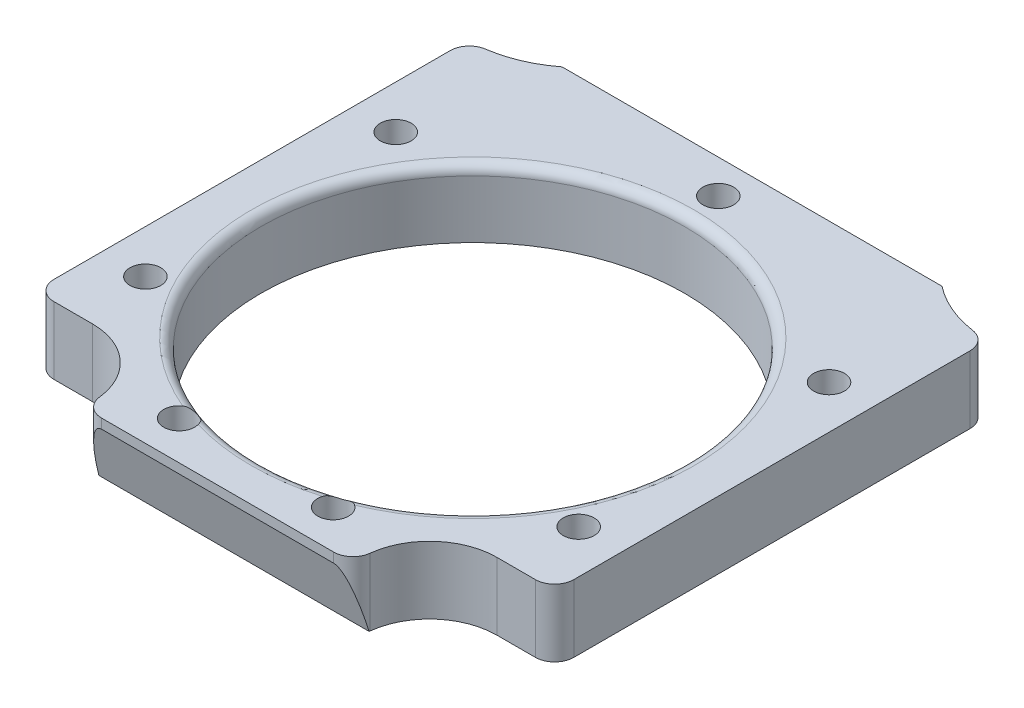
from build123d import *

# Parameters (mm, degrees)
EXTRUDE_1_DEPTH          = 5
SKETCH_3_R               = 22
CUT_EXTRUDE_1_DEPTH      = 75.79973262
SKETCH_4_R               = 1.6
CUT_EXTRUDE_3_DEPTH      = 75.79973262
SKETCH_9_R               = 1.6
SKETCH_9_R_2             = 22
EXTRUDE_2_DEPTH          = 2
FILLET_1_R               = 1
CUT_EXTRUDE_4_DEPTH      = 68.779052811
CUT_EXTRUDE_4_DEPTH_BACK = 68.779052811


with BuildPart() as part:
    # Эскиз2 → Бобышка-Вытянуть1 (new body)
    with BuildSketch(Plane(origin=(0, -5, 0), x_dir=(-1, 0, 0), z_dir=(0, -1, 0))):
        with BuildLine():
            Line((-28.05572809, -61), (-3.94427191, -61))
            ThreePointArc((-3.94427191, -61), (-2.610938577, -60.490711985), (-1.95665593, -59.222222222))
            ThreePointArc((-1.95665593, -59.222222222), (0.333333333, -54.782508053), (5, -53))
            Line((5, -53), (9, -53))
            ThreePointArc((9, -53), (10.414213562, -52.414213562), (11, -51))
            Line((11, -51), (11, -9.854480973))
            ThreePointArc((11, -9.854480973), (10.513111175, -8.546622199), (9.289505428, -7.875545247))
            ThreePointArc((9.289505428, -7.875545247), (6.355962769, -7.049175653), (3.731345838, -5.5))
            Line((3.731345838, -5.5), (-35.731345838, -5.5))
            ThreePointArc((-35.731345838, -5.5), (-38.355962769, -7.049175653), (-41.289505428, -7.875545247))
            ThreePointArc((-41.289505428, -7.875545247), (-42.513111175, -8.546622199), (-43, -9.854480973))
            Line((-43, -9.854480973), (-43, -51))
            ThreePointArc((-43, -51), (-42.414213562, -52.414213562), (-41, -53))
            Line((-41, -53), (-37, -53))
            ThreePointArc((-37, -53), (-32.333333333, -54.782508053), (-30.04334407, -59.222222222))
            ThreePointArc((-30.04334407, -59.222222222), (-29.389061423, -60.490711985), (-28.05572809, -61))
        make_face()
    extrude(amount=EXTRUDE_1_DEPTH)

    # Эскиз3 → Вырез-Вытянуть1 (cut, through all)
    with BuildSketch(Plane.XZ.offset(10)):
        with Locations(Location((16, 34.5, 0), (0, 0, 270))):
            Circle(SKETCH_3_R)
    extrude(amount=-CUT_EXTRUDE_1_DEPTH, mode=Mode.SUBTRACT)

    # Эскиз4 → Вырез-Вытянуть3 (cut, through all)
    with BuildSketch(Plane.XZ.offset(10)):
        with Locations(Location((38.5, 20, 0), (0, 0, 270))):
            Circle(SKETCH_4_R)
        with Locations(Location((-6.5, 20, 0), (0, 0, 270))):
            Circle(SKETCH_4_R)
        with Locations(Location((-6.5, 46, 0), (0, 0, 270))):
            Circle(SKETCH_4_R)
        with Locations(Location((38.5, 46, 0), (0, 0, 270))):
            Circle(SKETCH_4_R)
        with Locations(Location((24, 57, 0), (0, 0, 270))):
            Circle(SKETCH_4_R)
        with Locations(Location((8, 57, 0), (0, 0, 270))):
            Circle(SKETCH_4_R)
        with Locations(Location((16, 9, 0), (0, 0, 270))):
            Circle(SKETCH_4_R)
    extrude(amount=-CUT_EXTRUDE_3_DEPTH, mode=Mode.SUBTRACT)

    # Эскиз9 → Бобышка-Вытянуть2 (add)
    with BuildSketch(Plane.XZ.offset(10)):
        with BuildLine():
            Line((28.05572809, 61), (3.94427191, 61))
            ThreePointArc((3.94427191, 61), (2.610938577, 60.490711985), (1.95665593, 59.222222222))
            ThreePointArc((1.95665593, 59.222222222), (-0.333333333, 54.782508053), (-5, 53))
            Line((-5, 53), (-9, 53))
            ThreePointArc((-9, 53), (-10.414213562, 52.414213562), (-11, 51))
            Line((-11, 51), (-11, 9.854480973))
            ThreePointArc((-11, 9.854480973), (-10.513111175, 8.546622199), (-9.289505428, 7.875545247))
            ThreePointArc((-9.289505428, 7.875545247), (-6.355962769, 7.049175653), (-3.731345838, 5.5))
            Line((-3.731345838, 5.5), (35.731345838, 5.5))
            ThreePointArc((35.731345838, 5.5), (38.355962769, 7.049175653), (41.289505428, 7.875545247))
            ThreePointArc((41.289505428, 7.875545247), (42.513111175, 8.546622199), (43, 9.854480973))
            Line((43, 9.854480973), (43, 51))
            ThreePointArc((43, 51), (42.414213562, 52.414213562), (41, 53))
            Line((41, 53), (37, 53))
            ThreePointArc((37, 53), (32.333333333, 54.782508053), (30.04334407, 59.222222222))
            ThreePointArc((30.04334407, 59.222222222), (29.389061423, 60.490711985), (28.05572809, 61))
        make_face()
        with Locations(Location((38.5, 46, 0), (0, 0, 270))):
            Circle(SKETCH_9_R, mode=Mode.SUBTRACT)
        with Locations(Location((24, 57, 0), (0, 0, 270))):
            Circle(SKETCH_9_R, mode=Mode.SUBTRACT)
        with Locations(Location((38.5, 20, 0), (0, 0, 270))):
            Circle(SKETCH_9_R, mode=Mode.SUBTRACT)
        with Locations(Location((16, 9, 0), (0, 0, 270))):
            Circle(SKETCH_9_R, mode=Mode.SUBTRACT)
        with Locations(Location((-6.5, 20, 0), (0, 0, 270))):
            Circle(SKETCH_9_R, mode=Mode.SUBTRACT)
        with Locations(Location((-6.5, 46, 0), (0, 0, 270))):
            Circle(SKETCH_9_R, mode=Mode.SUBTRACT)
        with Locations(Location((8, 57, 0), (0, 0, 270))):
            Circle(SKETCH_9_R, mode=Mode.SUBTRACT)
        with Locations(Location((16, 34.5, 0), (0, 0, 270))):
            Circle(SKETCH_9_R_2, mode=Mode.SUBTRACT)
    extrude(amount=EXTRUDE_2_DEPTH)

    # Скругление1
    # the kernel refuses this fillet: 1 mm, written as the material it takes off along each edge
    with BuildSketch(Plane(origin=(16, -5, 34.5), x_dir=(0, 0, -1), z_dir=(-1, 0, 0))) as fillet_1_piece_1:
        with BuildLine():
            CenterArc((22 + FILLET_1_R, FILLET_1_R), FILLET_1_R, 180, 90)
            Line((22, FILLET_1_R), (22, 0))
            Line((22, 0), (22 + FILLET_1_R, 0))
        make_face()
    revolve(axis=Axis((16, -5, 34.5), (0, -1, 0)), mode=Mode.SUBTRACT)

    # Эскиз12 → Вырез-Вытянуть4 (cut, two sides: drawn at the far end of the back side and taken through both)
    with BuildSketch(Plane(origin=(16, 0, 0), x_dir=(0, 0, 1), z_dir=(1, 0, 0)).offset(-CUT_EXTRUDE_4_DEPTH_BACK)):
        Polygon((61, 12), (61, 6), (59.3, 12), align=None)
    extrude(amount=CUT_EXTRUDE_4_DEPTH + CUT_EXTRUDE_4_DEPTH_BACK, mode=Mode.SUBTRACT)


solid = part.part
